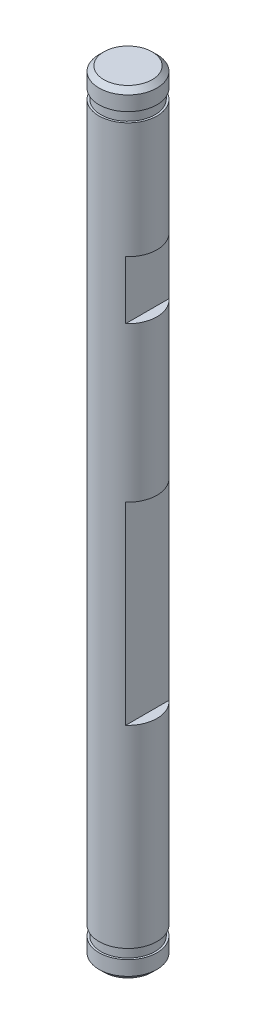
from build123d import *

# Parameters (mm, degrees)
CROQUIS1_R              = 3
SALIENTE_EXTRUIR1_DEPTH = 80
CROQUIS2_W              = 5.431234996
CROQUIS2_H              = 1
CORTAR_EXTRUIR1_REACH   = 84.112
CORTAR_EXTRUIR1_START   = 2
CROQUIS3_W              = 6
CROQUIS3_H              = 6
CORTAR_EXTRUIR4_REACH   = 84.112
CORTAR_EXTRUIR4_START   = 2
CROQUIS3_4_W            = 6
CROQUIS3_4_H            = 20
CHAFL_N1_SIZE           = 0.5


with BuildPart() as part:
    # Croquis1 → Saliente-Extruir1 (new body)
    with BuildSketch(Plane(origin=(0, 0, 0), x_dir=(1, 0, 0), z_dir=(0, 1, 0))):
        Circle(CROQUIS1_R)
    extrude(amount=SALIENTE_EXTRUIR1_DEPTH)

    # Croquis2 → Cortar-Revolución1 (revolve, cut)
    with BuildSketch(Plane.XY):
        with Locations((5.515617498, 77.5)):
            Rectangle(CROQUIS2_W, CROQUIS2_H)
        with Locations((5.515617498, 2.5)):
            Rectangle(CROQUIS2_W, CROQUIS2_H)
    revolve(axis=Axis((0, 80, 0), (0, -1, 0)), mode=Mode.SUBTRACT)

    # Croquis3 → Cortar-Extruir1 (cut, up to next)
    with BuildSketch(Plane(origin=(0, 0, 0), x_dir=(0, 0, -1), z_dir=(1, 0, 0)).offset(CORTAR_EXTRUIR1_START), mode=Mode.PRIVATE) as cortar_extruir1_sk1:
        with Locations((0, 62)):
            Rectangle(CROQUIS3_W, CROQUIS3_H)
    cortar_extruir1_tool1 = extrude(cortar_extruir1_sk1.sketch, amount=CORTAR_EXTRUIR1_REACH, mode=Mode.PRIVATE) & part.part
    add(cortar_extruir1_tool1.solids().sort_by_distance((2, 62, 0))[0], mode=Mode.SUBTRACT)

    # Croquis3<4> → Cortar-Extruir4 (cut, up to next)
    with BuildSketch(Plane(origin=(0, 0, 0), x_dir=(0, 0, -1), z_dir=(1, 0, 0)).offset(CORTAR_EXTRUIR4_START), mode=Mode.PRIVATE) as cortar_extruir4_sk1:
        with Locations((0, 33)):
            Rectangle(CROQUIS3_4_W, CROQUIS3_4_H)
    cortar_extruir4_tool1 = extrude(cortar_extruir4_sk1.sketch, amount=CORTAR_EXTRUIR4_REACH, mode=Mode.PRIVATE) & part.part
    add(cortar_extruir4_tool1.solids().sort_by_distance((2, 33, 0))[0], mode=Mode.SUBTRACT)

    # Chaflán1
    chafl_n1_edges = [part.edges().sort_by_distance(p)[0] for p in [
        (-3, 0, 0),
        (-3, 80, 0),
    ]]
    chamfer(chafl_n1_edges, length=CHAFL_N1_SIZE)


solid = part.part
